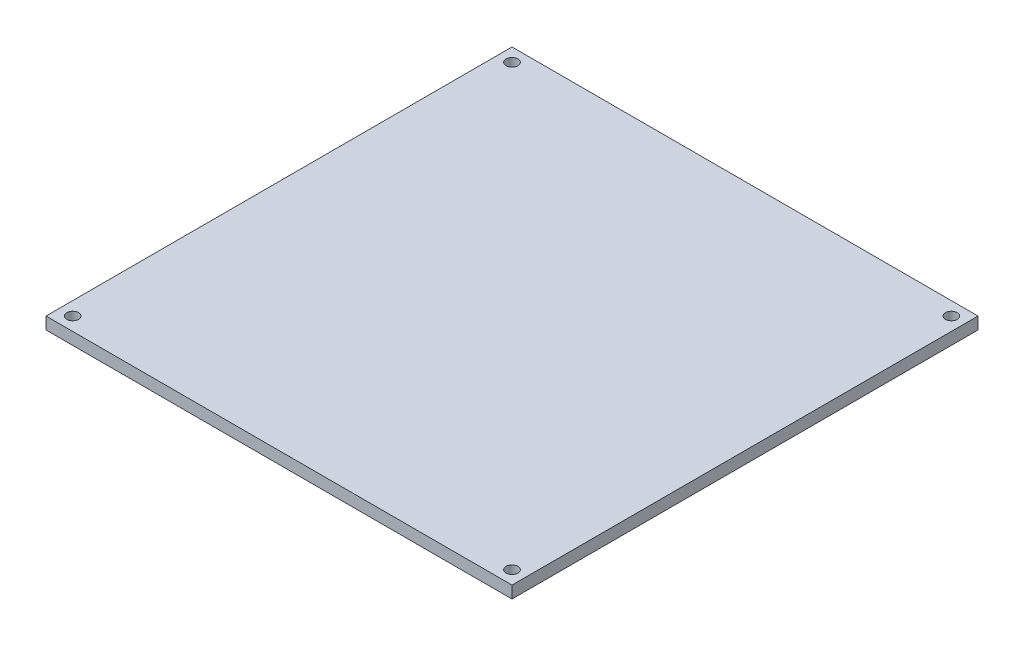
from build123d import *

# Parameters (mm, degrees)
SKETCH1_W           = 77
SKETCH1_H           = 77
SKETCH1_R           = 0.973455396
BOSS_EXTRUDE1_DEPTH = 2


with BuildPart() as part:
    # Sketch1 → Boss-Extrude1 (new body)
    with BuildSketch(Plane(origin=(0, 0, 0), x_dir=(1, 0, 0), z_dir=(0, 1, 0))):
        with Locations((-9, 25.054332031)):
            Rectangle(SKETCH1_W, SKETCH1_H)
        with Locations((-45.3, 61.354332031)):
            Circle(SKETCH1_R, mode=Mode.SUBTRACT)
        with Locations((27.3, 61.354332031)):
            Circle(SKETCH1_R, mode=Mode.SUBTRACT)
        with Locations((-45.3, -11.245667969)):
            Circle(SKETCH1_R, mode=Mode.SUBTRACT)
        with Locations((27.3, -11.245667969)):
            Circle(SKETCH1_R, mode=Mode.SUBTRACT)
    extrude(amount=BOSS_EXTRUDE1_DEPTH)


solid = part.part
